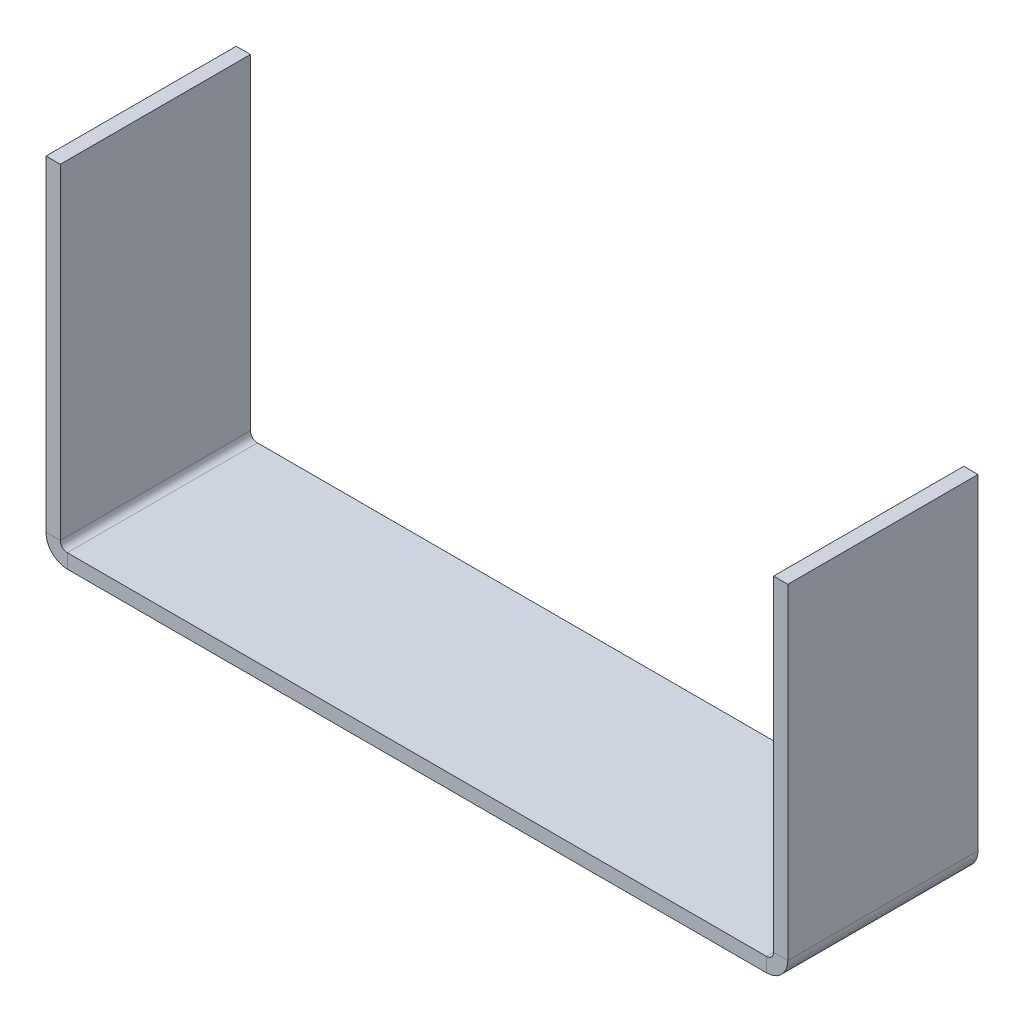
from build123d import *

# Parameters (mm, degrees)
SKETCH_1_W                       = 78
SKETCH_1_H                       = 20
SM_BASE_FLANGE_1_DEPTH           = 1.5
SM_EDGE_FLANGE_1_STRIP_W         = 7.4732
SM_EDGE_FLANGE_1_STRIP_H         = 1.5
SM_EDGE_FLANGE_1_STRIP_CUT_DEPTH = 20
SM_EDGE_FLANGE_1_DEPTH           = 20
SM_EDGE_FLANGE_2_STRIP_W         = 7.4732
SM_EDGE_FLANGE_2_STRIP_H         = 1.5
SM_EDGE_FLANGE_2_STRIP_CUT_DEPTH = 20
SM_EDGE_FLANGE_2_DEPTH           = 20


# Sheet-metal steps are written as plain solids
with BuildPart() as part:
    # Sketch 1 → Базовая кромка1 (new body)
    with BuildSketch(Plane(origin=(0, 0, 0), x_dir=(1, 0, 0), z_dir=(0, 1, 0))):
        with Locations((39, 10)):
            Rectangle(SKETCH_1_W, SKETCH_1_H)
    extrude(amount=-SM_BASE_FLANGE_1_DEPTH)

    # Ребро-кромка1 strip (across the edge) → Ребро-кромка1 strip cut (cut)
    with BuildSketch(Plane.XY.offset(-20)):
        with Locations((-1.5, -0.75)):
            Rectangle(SM_EDGE_FLANGE_1_STRIP_W, SM_EDGE_FLANGE_1_STRIP_H)
    extrude(amount=SM_EDGE_FLANGE_1_STRIP_CUT_DEPTH, mode=Mode.SUBTRACT)

    # Ребро-кромка1 section (across the edge) → Ребро-кромка1 (add)
    with BuildSketch(Plane.XY.offset(-20)):
        with BuildLine():
            Line((0, 0.7366), (0, 35))
            Line((0, 35), (1.5, 35))
            Line((1.5, 35), (1.5, 0.7366))
            ThreePointArc((1.5, 0.7366), (1.715745145, 0.215745145), (2.2366, 0))
            Line((2.2366, 0), (2.2366, -1.5))
            ThreePointArc((2.2366, -1.5), (0.655084973, -0.844915027), (0, 0.7366))
        make_face()
    extrude(amount=SM_EDGE_FLANGE_1_DEPTH)

    # Ребро-кромка2 strip (across the edge) → Ребро-кромка2 strip cut (cut)
    with BuildSketch(Plane(origin=(78, 0, 0), x_dir=(-1, 0, 0), z_dir=(0, 0, -1))):
        with Locations((-1.5, -0.75)):
            Rectangle(SM_EDGE_FLANGE_2_STRIP_W, SM_EDGE_FLANGE_2_STRIP_H)
    extrude(amount=SM_EDGE_FLANGE_2_STRIP_CUT_DEPTH, mode=Mode.SUBTRACT)

    # Ребро-кромка2 section (across the edge) → Ребро-кромка2 (add)
    with BuildSketch(Plane(origin=(78, 0, 0), x_dir=(-1, 0, 0), z_dir=(0, 0, -1))):
        with BuildLine():
            Line((0, 0.7366), (0, 35))
            Line((0, 35), (1.5, 35))
            Line((1.5, 35), (1.5, 0.7366))
            ThreePointArc((1.5, 0.7366), (1.715745145, 0.215745145), (2.2366, 0))
            Line((2.2366, 0), (2.2366, -1.5))
            ThreePointArc((2.2366, -1.5), (0.655084973, -0.844915027), (0, 0.7366))
        make_face()
    extrude(amount=SM_EDGE_FLANGE_2_DEPTH)


solid = part.part
